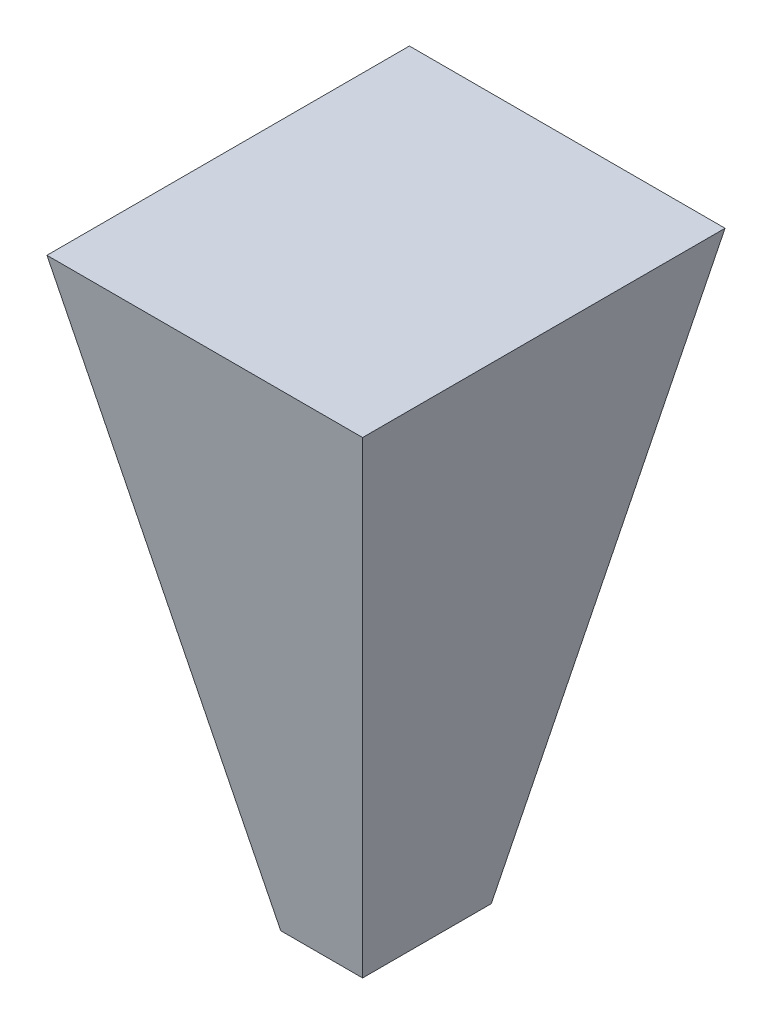
from build123d import *

# Parameters (mm, degrees)
SKETCH1_W           = 7
SKETCH1_H           = 11
BOSS_EXTRUDE1_DEPTH = 50
BOSS_EXTRUDE1_TAPER = -11.3


with BuildPart() as part:
    # Sketch1 → Boss-Extrude1 (new body)
    with BuildSketch(Plane(origin=(0, 0, 0), x_dir=(1, 0, 0), z_dir=(0, 1, 0))):
        Rectangle(SKETCH1_W, SKETCH1_H)
    extrude(amount=BOSS_EXTRUDE1_DEPTH, taper=BOSS_EXTRUDE1_TAPER)


solid = part.part
